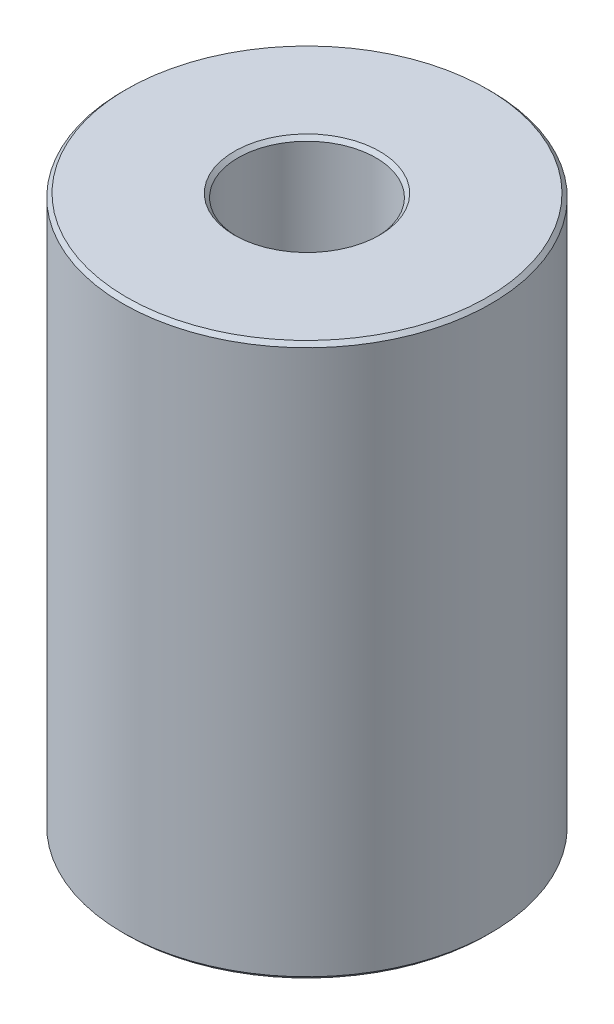
from build123d import *
from OCP.BRepFilletAPI import BRepFilletAPI_MakeChamfer

# Parameters (mm, degrees)
SKETCH1_R           = 12.5
BOSS_EXTRUDE1_DEPTH = 37.500835042
SKETCH2_R           = 4.68221709
CUT_EXTRUDE1_DEPTH  = 42.458565205
CHAMFER1_SIZE       = 0.251550273
CHAMFER1_SIZE2      = 0.253157677


with BuildPart() as part:
    # Sketch1 → Boss-Extrude1 (new body)
    with BuildSketch(Plane(origin=(0, 0, 0), x_dir=(1, 0, 0), z_dir=(0, 1, 0))):
        Circle(SKETCH1_R)
    extrude(amount=BOSS_EXTRUDE1_DEPTH)

    # Sketch2 → Cut-Extrude1 (cut, through all)
    with BuildSketch(Plane(origin=(0, 0, 0), x_dir=(1, 0, 0), z_dir=(0, 1, 0))):
        Circle(SKETCH2_R)
    extrude(amount=CUT_EXTRUDE1_DEPTH, mode=Mode.SUBTRACT)

    # Chamfer1: one chamfer whose edges measure the first distance from different faces: ONE call of the kernel's chamfer builder (chamfer() names one face for all edges)
    chamfer1_edges_1 = [part.edges().sort_by_distance(p)[0] for p in [
        (-4.68221709, 37.500835042, 0),
    ]]
    chamfer1_side_1 = [part.faces().sort_by_distance(p)[0] for p in [
        (-12.146446609, 37.500835042, 0),
    ]]
    chamfer1_edges_2 = [part.edges().sort_by_distance(p)[0] for p in [
        (-4.68221709, 0, 0),
    ]]
    chamfer1_side_2 = [part.faces().sort_by_distance(p)[0] for p in [
        (-4.68221709, 18.750417521, 0),
    ]]
    chamfer1_edges_3 = [part.edges().sort_by_distance(p)[0] for p in [
        (-12.5, 0, 0),
    ]]
    chamfer1_side_3 = [part.faces().sort_by_distance(p)[0] for p in [
        (-12.146446609, 0, 0),
    ]]
    chamfer1_edges_4 = [part.edges().sort_by_distance(p)[0] for p in [
        (-12.5, 37.500835042, 0),
    ]]
    chamfer1_side_4 = [part.faces().sort_by_distance(p)[0] for p in [
        (-12.5, 18.750417521, 0),
    ]]
    chamfer1 = BRepFilletAPI_MakeChamfer(part.part.solid().wrapped)
    for e in chamfer1_edges_1:
        chamfer1.Add(CHAMFER1_SIZE, CHAMFER1_SIZE2, e.wrapped, chamfer1_side_1[0].wrapped)  # the first distance lies on this face
    for e in chamfer1_edges_2:
        chamfer1.Add(CHAMFER1_SIZE, CHAMFER1_SIZE2, e.wrapped, chamfer1_side_2[0].wrapped)  # the first distance lies on this face
    for e in chamfer1_edges_3:
        chamfer1.Add(CHAMFER1_SIZE, CHAMFER1_SIZE2, e.wrapped, chamfer1_side_3[0].wrapped)  # the first distance lies on this face
    for e in chamfer1_edges_4:
        chamfer1.Add(CHAMFER1_SIZE, CHAMFER1_SIZE2, e.wrapped, chamfer1_side_4[0].wrapped)  # the first distance lies on this face
    add(Compound.cast(chamfer1.Shape()), mode=Mode.REPLACE)


solid = part.part
